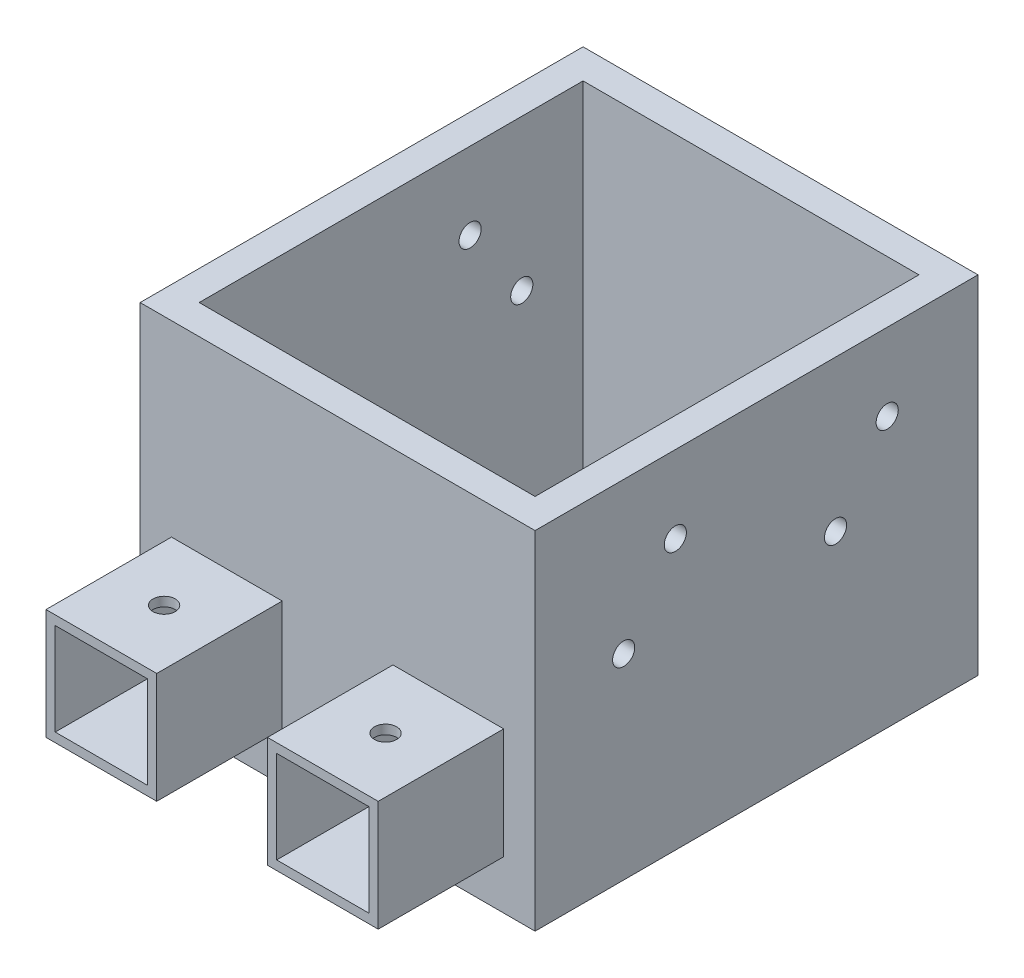
from build123d import *

# Parameters (mm, degrees)
SKETCH1_W           = 53.5
SKETCH1_H           = 60
SKETCH1_W_2         = 45.5
SKETCH1_H_2         = 52
BOSS_EXTRUDE1_DEPTH = 47
CUT_EXTRUDE1_START  = -4
SKETCH3_R           = 1.5
CUT_EXTRUDE1_DEPTH  = 82.273863628
LPATTERN1_COUNT     = 2
LPATTERN1_PITCH     = 28.7
SKETCH4_R           = 1.5
CUT_EXTRUDE2_DEPTH  = 4
LPATTERN2_COUNT     = 2
LPATTERN2_PITCH     = 28.7
SKETCH5_W           = 15
SKETCH5_H           = 15
SKETCH5_W_2         = 12.5
SKETCH5_H_2         = 12.5
BOSS_EXTRUDE2_DEPTH = 17
SKETCH6_R           = 1.5
CUT_EXTRUDE3_DEPTH  = 60.742904181


with BuildPart() as part:
    # Sketch1 → Boss-Extrude1 (new body)
    with BuildSketch(Plane(origin=(0, 0, 0), x_dir=(1, 0, 0), z_dir=(0, 1, 0))):
        Rectangle(SKETCH1_W, SKETCH1_H)
        Rectangle(SKETCH1_W_2, SKETCH1_H_2, mode=Mode.SUBTRACT)
    extrude(amount=BOSS_EXTRUDE1_DEPTH)

    # Sketch3 → Cut-Extrude1 (cut)
    with BuildSketch(Plane.ZY.offset(26.75).offset(CUT_EXTRUDE1_START)):
        with Locations((18, 36.55)):
            Circle(SKETCH3_R)
        with Locations((11, 26.55)):
            Circle(SKETCH3_R)
    cut_extrude1 = extrude(amount=CUT_EXTRUDE1_DEPTH, mode=Mode.SUBTRACT)

    # LPattern1: Cut-Extrude1 ×2
    with Locations(*[(0, 0, -i * LPATTERN1_PITCH) for i in range(1, LPATTERN1_COUNT)]):
        add(cut_extrude1, mode=Mode.SUBTRACT)

    # Sketch4 → Cut-Extrude2 (cut)
    with BuildSketch(Plane(origin=(26.75, 0, 0), x_dir=(0, 0, -1), z_dir=(1, 0, 0))):
        with Locations((-11, 36.55)):
            Circle(SKETCH4_R)
        with Locations((-18, 26.55)):
            Circle(SKETCH4_R)
    cut_extrude2 = extrude(amount=-CUT_EXTRUDE2_DEPTH, mode=Mode.SUBTRACT)

    # LPattern2: Cut-Extrude2 ×2
    with Locations(*[(0, 0, -i * LPATTERN2_PITCH) for i in range(1, LPATTERN2_COUNT)]):
        add(cut_extrude2, mode=Mode.SUBTRACT)

    # Sketch5 → Boss-Extrude2 (add)
    # profile 1 of 2: a face of its own
    with BuildSketch(Plane.XY.offset(30)):
        with Locations((-15, 14.11)):
            Rectangle(SKETCH5_W, SKETCH5_H)
        with Locations((-15, 14.11)):
            Rectangle(SKETCH5_W_2, SKETCH5_H_2, mode=Mode.SUBTRACT)
    # profile 2 of 2: a face of its own
    with BuildSketch(Plane.XY.offset(30)):
        with Locations((15, 14.11)):
            Rectangle(SKETCH5_W, SKETCH5_H)
        with Locations((15, 14.11)):
            Rectangle(SKETCH5_W_2, SKETCH5_H_2, mode=Mode.SUBTRACT)
    extrude(amount=BOSS_EXTRUDE2_DEPTH)

    # Sketch6 → Cut-Extrude3 (cut, through all)
    with BuildSketch(Plane(origin=(0, 21.61, 0), x_dir=(1, 0, 0), z_dir=(0, 1, 0))):
        with Locations((-15, -38.5)):
            Circle(SKETCH6_R)
        with Locations((15, -38.5)):
            Circle(SKETCH6_R)
    extrude(amount=-CUT_EXTRUDE3_DEPTH, mode=Mode.SUBTRACT)


solid = part.part
